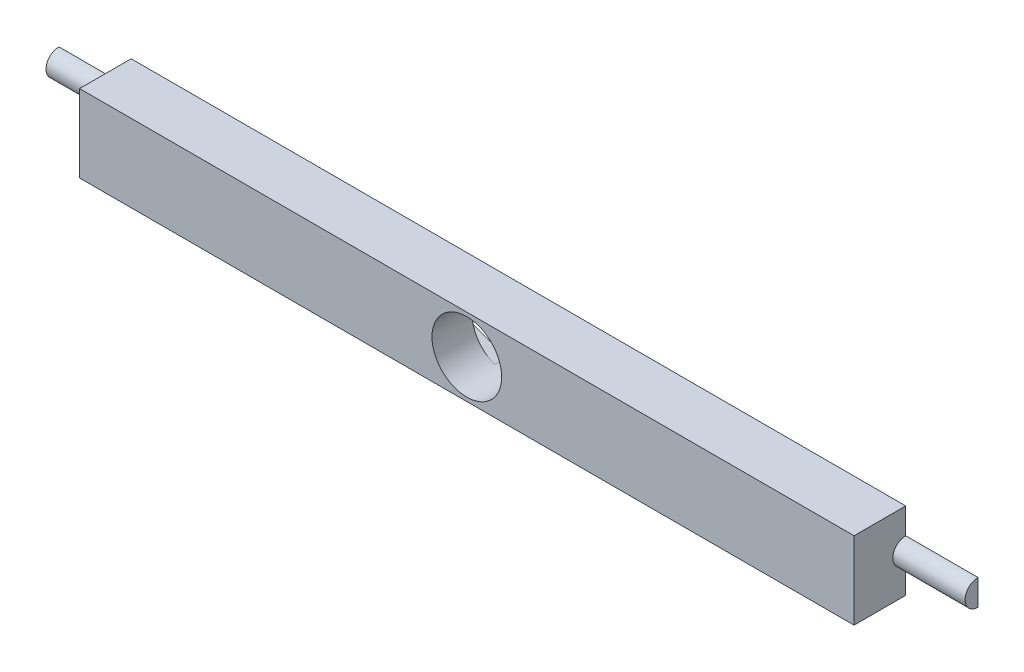
from build123d import *

# Parameters (mm, degrees)
SKETCH_1_W           = 300
SKETCH_1_H           = 30
EXTRUDE_1_DEPTH      = 20
EXTRUDE_2_DEPTH      = 28
EXTRUDE_2_DEPTH_BACK = 328
SKETCH_3_R           = 13.5
CUT_EXTRUDE_2_DEPTH  = 182.614977356
SKETCH_3_4_R         = 2.4
CUT_EXTRUDE_3_DEPTH  = 4.5
SKETCH_3_5_R         = 2.4
CUT_EXTRUDE_4_DEPTH  = 5


with BuildPart() as part:
    # 草图1 → 凸台-拉伸1 (new body)
    with BuildSketch(Plane.XY):
        with Locations((0, 15)):
            Rectangle(SKETCH_1_W, SKETCH_1_H)
    extrude(amount=EXTRUDE_1_DEPTH)

    # 草图2 → 凸台-拉伸2 (add, two sides: drawn at the far end of the back side and taken through both)
    with BuildSketch(Plane.ZY.offset(150).offset(-EXTRUDE_2_DEPTH_BACK)):
        with BuildLine():
            Line((0, 20), (0, 10))
            ThreePointArc((0, 10), (5, 15), (0, 20))
        make_face()
    extrude(amount=EXTRUDE_2_DEPTH + EXTRUDE_2_DEPTH_BACK)

    # 草图3 → 切除-拉伸2 (cut, through all)
    with BuildSketch(Plane(origin=(0, 0, 0), x_dir=(-1, 0, 0), z_dir=(0, 0, -1))):
        with Locations((0, 15)):
            Circle(SKETCH_3_R)
    extrude(amount=-CUT_EXTRUDE_2_DEPTH, mode=Mode.SUBTRACT)

    # 草图3<4> → 切除-拉伸3 (cut)
    # profile 1 of 2: a face of its own
    with BuildSketch(Plane(origin=(0, 0, 0), x_dir=(-1, 0, 0), z_dir=(0, 0, -1))):
        with BuildLine():
            Line((25.573684211, 19.923075858), (4.689473684, 27.65933792))
            ThreePointArc((4.689473684, 27.65933792), (13.5, 15), (4.689473684, 2.34066208))
            Line((4.689473684, 2.34066208), (25.573684211, 10.076924142))
            ThreePointArc((25.573684211, 10.076924142), (29, 15), (25.573684211, 19.923075858))
        make_face()
        with Locations((23.75, 15)):
            Circle(SKETCH_3_4_R, mode=Mode.SUBTRACT)
    # profile 2 of 2: a face of its own
    with BuildSketch(Plane(origin=(0, 0, 0), x_dir=(-1, 0, 0), z_dir=(0, 0, -1))):
        with BuildLine():
            ThreePointArc((-4.689473684, 2.34066208), (-13.5, 15), (-4.689473684, 27.65933792))
            Line((-4.689473684, 27.65933792), (-25.573684211, 19.923075858))
            ThreePointArc((-25.573684211, 19.923075858), (-29, 15), (-25.573684211, 10.076924142))
            Line((-25.573684211, 10.076924142), (-4.689473684, 2.34066208))
        make_face()
        with Locations((-23.75, 15)):
            Circle(SKETCH_3_4_R, mode=Mode.SUBTRACT)
    extrude(amount=-CUT_EXTRUDE_3_DEPTH, mode=Mode.SUBTRACT)

    # 草图3<5> → 切除-拉伸4 (cut)
    with BuildSketch(Plane(origin=(0, 0, 0), x_dir=(-1, 0, 0), z_dir=(0, 0, -1))):
        with Locations((-23.75, 15)):
            Circle(SKETCH_3_5_R)
        with Locations((23.75, 15)):
            Circle(SKETCH_3_5_R)
    extrude(amount=-CUT_EXTRUDE_4_DEPTH, mode=Mode.SUBTRACT)


solid = part.part
